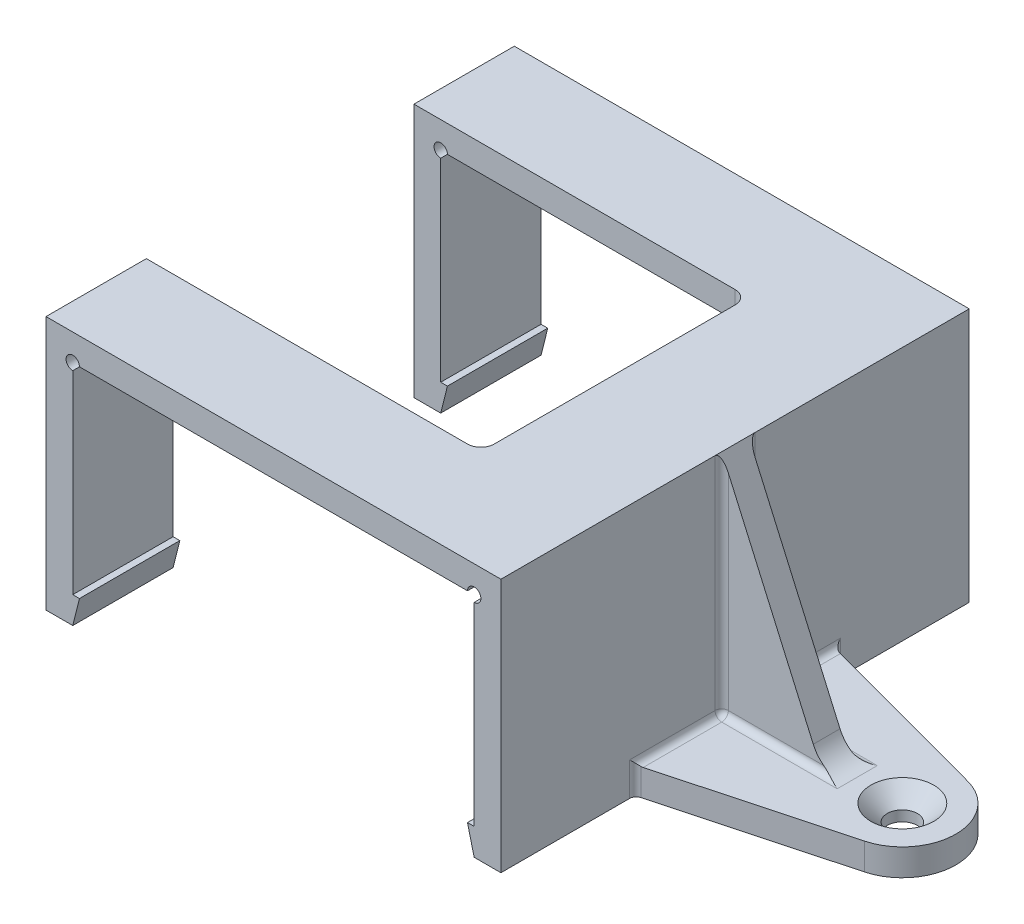
from build123d import *

# Parameters (mm, degrees)
FORME_PRINCIPALE_DEPTH  = 35
ESQUISSE3_W             = 50
ESQUISSE3_H             = 40
VIDEMENT_DEPTH          = 86.399063227
BOSSAGE_CROU_DEPTH      = 4
NERVURE3_REACH          = 115.446
ESQUISSE9_WALL_W        = 266.053853166
ESQUISSE9_WALL_H        = 4
CONG_2_R                = 1
CONG_3_R                = 5
CONG_4_R                = 2
ESQUISSE10_R            = 1
ENL_V_MAT_EXTRU_1_DEPTH = 129.627368783
ESQUISSE11_W            = 1
ESQUISSE11_H            = 40
ENL_V_MAT_EXTRU_2_DEPTH = 113.169514575


with BuildPart() as part:
    # Esquisse1 → Forme principale (new, symmetric)
    with BuildSketch(Plane.XY):
        Polygon((0, -38), (0, 0), (68, 0), (68, -38), (64, -38), (63, -34), (64, -34), (64, -4), (4, -4), (4, -34), (5, -34), (4, -38), align=None)
    extrude(amount=FORME_PRINCIPALE_DEPTH, both=True)

    # Esquisse3 → videment (cut, through all)
    with BuildSketch(Plane(origin=(0, 0, 0), x_dir=(1, 0, 0), z_dir=(0, 1, 0))):
        with Locations((25, 0)):
            Rectangle(ESQUISSE3_W, ESQUISSE3_H)
    extrude(amount=-VIDEMENT_DEPTH, mode=Mode.SUBTRACT)

    # Esquisse4 → Bossage écrou (add)
    with BuildSketch(Plane.XZ.offset(38)):
        with BuildLine():
            Line((68, 15), (95.075627041, 7.726045068))
            ThreePointArc((95.075627041, 7.726045068), (101, 0), (95.075627041, -7.726045068))
            Line((95.075627041, -7.726045068), (68, -15))
            Line((68, -15), (68, 15))
        make_face()
    extrude(amount=-BOSSAGE_CROU_DEPTH)

    # Esquisse7 → Fraisage pour vis à tête fraisée M41 (revolve, cut)
    with BuildSketch(Plane(origin=(93, -34, 0), x_dir=(0, 0, 1), z_dir=(1, 0, 0))):
        Polygon((0, 0), (0, 4.00005), (2.25, 4.00005), (2.25, 2.45), (4.7, 0), align=None)
    revolve(axis=Axis((93, -27.65, 0), (0, -1, 0)), mode=Mode.SUBTRACT)

    # Esquisse9 wall → Nervure3 (add, up to next)
    with BuildSketch(Plane(origin=(75.5, -17, 0), x_dir=(0.403640206576, -0.914917801573, 0), z_dir=(0.914917801573, 0.403640206576, 0)), mode=Mode.PRIVATE) as nervure3_sk1:
        Rectangle(ESQUISSE9_WALL_W, ESQUISSE9_WALL_H)
    nervure3_tool1 = extrude(nervure3_sk1.sketch, amount=-NERVURE3_REACH, mode=Mode.PRIVATE) - part.part
    add(nervure3_tool1.solids().sort_by_distance((75.5, -17, 0))[0])

    # Congé2
    cong_2_edges = [part.edges().sort_by_distance(p)[0] for p in [
        (68, -34, -8.5),
        (75.5, -34, -2),
        (68, -17, -2),
        (75.5, -34, 2),
        (68, -34, 8.5),
        (68, -17, 2),
        (68, -36, -15),
        (68, -36, 15),
    ]]
    fillet(cong_2_edges, radius=CONG_2_R)

    # Congé3
    cong_3_edges = [part.edges().sort_by_distance(p)[0] for p in [
        (83, -34, 0),
    ]]
    fillet(cong_3_edges, radius=CONG_3_R)

    # Congé4
    cong_4_edges = [part.edges().sort_by_distance(p)[0] for p in [
        (50, -2, -20),
        (50, -2, 20),
    ]]
    fillet(cong_4_edges, radius=CONG_4_R)

    # Esquisse10 → Enlèv. mat.-Extru.1 (cut, through all)
    with BuildSketch(Plane(origin=(0, 0, -35), x_dir=(-1, 0, 0), z_dir=(0, 0, -1))):
        with Locations((-64, -4)):
            Circle(ESQUISSE10_R)
        with Locations((-4, -4)):
            Circle(ESQUISSE10_R)
    extrude(amount=-ENL_V_MAT_EXTRU_1_DEPTH, mode=Mode.SUBTRACT)

    # Esquisse11 → Enlèv. mat.-Extru.2 (cut, through all)
    with BuildSketch(Plane(origin=(0, -34, 0), x_dir=(1, 0, 0), z_dir=(0, 1, 0))):
        with Locations((63.5, 0)):
            Rectangle(ESQUISSE11_W, ESQUISSE11_H)
    extrude(amount=-ENL_V_MAT_EXTRU_2_DEPTH, mode=Mode.SUBTRACT)


solid = part.part
